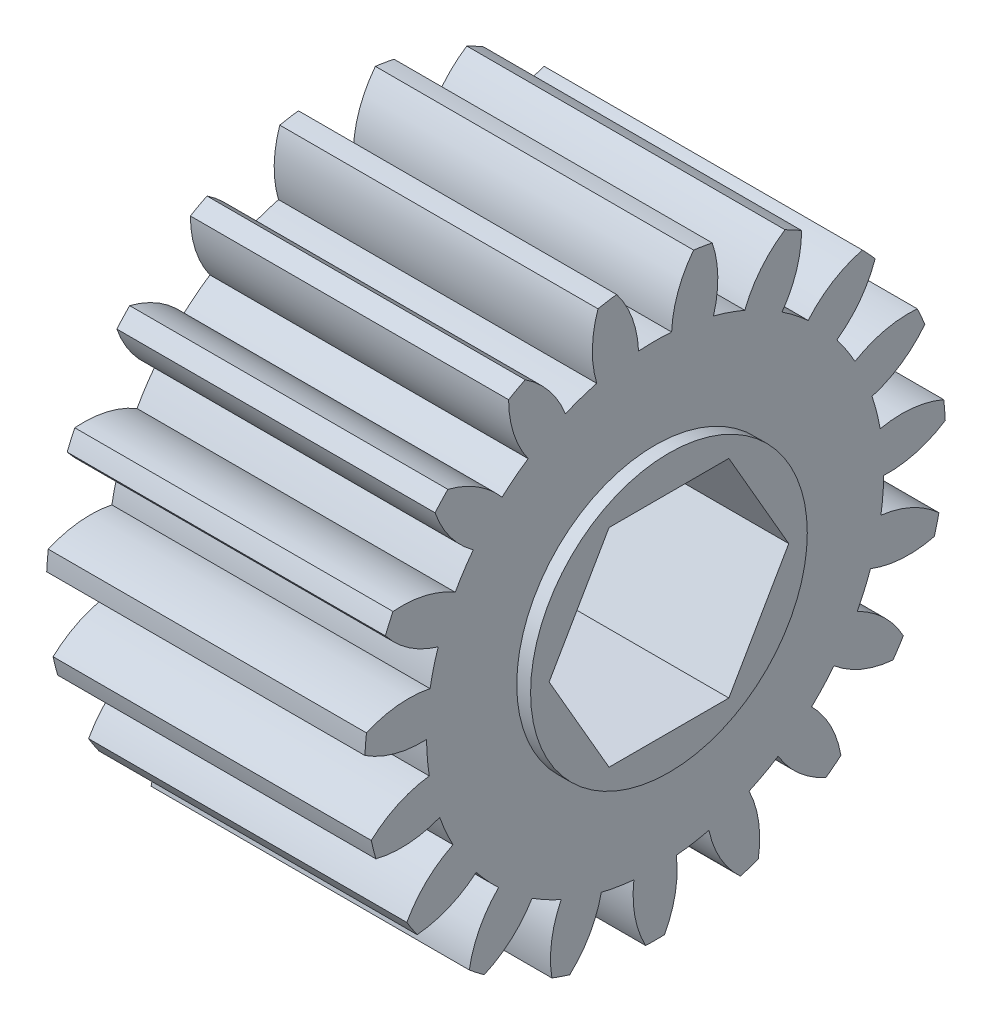
from build123d import *

# Parameters (mm, degrees)
SPUR_START             = -35.678146729
SPUR_GEAR_AI_OUTLINE_R = 4.7625
SPUR_GEAR_AI_DEPTH     = 14.605
SKETCH1_R              = 6.35
BOSS_EXTRUDE1_DEPTH    = 0.635
CUT_EXTRUDE1_DEPTH     = 54.813904544


# Read off the part's stored shape, not the designer's step: spur gear_ai
with BuildPart() as part:
    # spur gear_ai outline → spur gear_ai (new body)
    with BuildSketch(Plane.YZ.offset(SPUR_START)):
        with BuildLine():
            ThreePointArc((-4.079820471, 22.697443218), (-3.867365299, 23.075226512), (-3.667299754, 23.459714736))
            ThreePointArc((-3.667299754, 23.459714736), (-4.662813868, 24.560584868), (-5.94579254, 25.306861711))
            ThreePointArc((-5.94579254, 25.306861711), (-5.673335743, 26.015822626), (-5.452889632, 26.742638832))
            ThreePointArc((-5.452889632, 26.742638832), (-3.982066465, 26.54353431), (-2.52029752, 26.800818102))
            ThreePointArc((-2.52029752, 26.800818102), (-2.442019791, 27.227116136), (-2.377637471, 27.655732904))
            ThreePointArc((-2.377637471, 27.655732904), (-3.676663832, 28.373711952), (-5.132442876, 28.662970963))
            ThreePointArc((-5.132442876, 28.662970963), (-5.104947771, 29.421984997), (-5.132442876, 30.180999032))
            ThreePointArc((-5.132442876, 30.180999032), (-3.676663832, 30.470258044), (-2.377637471, 31.188237091))
            ThreePointArc((-2.377637471, 31.188237091), (-2.442019791, 31.616853859), (-2.52029752, 32.043151894))
            ThreePointArc((-2.52029752, 32.043151894), (-3.982066465, 32.300435686), (-5.452889632, 32.101331163))
            ThreePointArc((-5.452889632, 32.101331163), (-5.673335743, 32.82814737), (-5.94579254, 33.537108285))
            ThreePointArc((-5.94579254, 33.537108285), (-4.662813868, 34.283385128), (-3.667299754, 35.38425526))
            ThreePointArc((-3.667299754, 35.38425526), (-3.867365299, 35.768743484), (-4.079820471, 36.146526778))
            ThreePointArc((-4.079820471, 36.146526778), (-5.545926653, 35.915234624), (-6.872407431, 35.249342632))
            ThreePointArc((-6.872407431, 35.249342632), (-7.316906, 35.865199196), (-7.80479957, 36.447280076))
            ThreePointArc((-7.80479957, 36.447280076), (-6.833651916, 37.569704075), (-6.24952945, 38.934168931))
            ThreePointArc((-6.24952945, 38.934168931), (-6.563598014, 39.232863347), (-6.887207813, 39.521193218))
            ThreePointArc((-6.887207813, 39.521193218), (-8.198775879, 38.826389212), (-9.237169493, 37.76586948))
            ThreePointArc((-9.237169493, 37.76586948), (-9.857552203, 38.204028788), (-10.508011706, 38.596152137))
            ThreePointArc((-10.508011706, 38.596152137), (-9.953933988, 39.973091236), (-9.844501902, 41.453289877))
            ThreePointArc((-9.844501902, 41.453289877), (-10.238539284, 41.633822309), (-10.638235568, 41.801453743))
            ThreePointArc((-10.638235568, 41.801453743), (-11.653136766, 40.718430679), (-12.290917156, 39.378206976))
            ThreePointArc((-12.290917156, 39.378206976), (-13.019955914, 39.591187668), (-13.76249397, 39.750860836))
            ThreePointArc((-13.76249397, 39.750860836), (-13.685529105, 41.233102318), (-14.062646066, 42.668632254))
            ThreePointArc((-14.062646066, 42.668632254), (-14.4939522, 42.711439212), (-14.926421674, 42.740206741))
            ThreePointArc((-14.926421674, 42.740206741), (-15.534675712, 41.386326974), (-15.702729477, 39.911633334))
            ThreePointArc((-15.702729477, 39.911633334), (-16.461421622, 39.876355646), (-17.215572711, 39.78627557))
            ThreePointArc((-17.215572711, 39.78627557), (-17.624061036, 41.21319557), (-18.446860568, 42.448494858))
            ThreePointArc((-18.446860568, 42.448494858), (-18.868696742, 42.348937544), (-19.287074629, 42.23572376))
            ThreePointArc((-19.287074629, 42.23572376), (-19.422767744, 40.75770117), (-19.10288365, 39.308343531))
            ThreePointArc((-19.10288365, 39.308343531), (-19.809013115, 39.028630349), (-20.493053265, 38.698558601))
            ThreePointArc((-20.493053265, 38.698558601), (-21.342728733, 39.915528197), (-22.52204774, 40.816732991))
            ThreePointArc((-22.52204774, 40.816732991), (-22.88870146, 40.585599985), (-23.247650023, 40.342673359))
            ThreePointArc((-23.247650023, 40.342673359), (-22.89607776, 38.900674627), (-22.122920213, 37.633713378))
            ThreePointArc((-22.122920213, 37.633713378), (-22.699966914, 37.139875965), (-23.239769761, 36.605580942))
            ThreePointArc((-23.239769761, 36.605580942), (-24.43855685, 37.480722595), (-25.846597818, 37.950173372))
            ThreePointArc((-25.846597818, 37.950173372), (-26.118336464, 37.612511521), (-26.378958058, 37.266196922))
            ThreePointArc((-26.378958058, 37.266196922), (-25.578218727, 36.016484986), (-24.435571343, 35.069215037))
            ThreePointArc((-24.435571343, 35.069215037), (-24.821003316, 34.41476834), (-25.158072845, 33.734149197))
            ThreePointArc((-25.158072845, 33.734149197), (-26.576064374, 34.172627729), (-28.060244216, 34.159452214))
            ThreePointArc((-28.060244216, 34.159452214), (-28.20762069, 33.75185242), (-28.34167292, 33.339678407))
            ThreePointArc((-28.34167292, 33.339678407), (-27.178539052, 32.417678947), (-25.790225405, 31.892751696))
            ThreePointArc((-25.790225405, 31.892751696), (-25.942275116, 31.148615169), (-26.040084614, 30.395427551))
            ThreePointArc((-26.040084614, 30.395427551), (-27.523619197, 30.34972701), (-28.923103999, 29.855352973))
            ThreePointArc((-28.923103999, 29.855352973), (-28.930147771, 29.421984997), (-28.923103999, 28.988617022))
            ThreePointArc((-28.923103999, 28.988617022), (-27.523619197, 28.494242985), (-26.040084614, 28.448542445))
            ThreePointArc((-26.040084614, 28.448542445), (-25.942275116, 27.695354827), (-25.790225405, 26.9512183))
            ThreePointArc((-25.790225405, 26.9512183), (-27.178539052, 26.426291049), (-28.34167292, 25.504291588))
            ThreePointArc((-28.34167292, 25.504291588), (-28.20762069, 25.092117576), (-28.060244216, 24.684517782))
            ThreePointArc((-28.060244216, 24.684517782), (-26.576064374, 24.671342266), (-25.158072845, 25.109820799))
            ThreePointArc((-25.158072845, 25.109820799), (-24.821003316, 24.429201655), (-24.435571343, 23.774754958))
            ThreePointArc((-24.435571343, 23.774754958), (-25.578218727, 22.82748501), (-26.378958058, 21.577773074))
            ThreePointArc((-26.378958058, 21.577773074), (-26.118336464, 21.231458474), (-25.846597818, 20.893796624))
            ThreePointArc((-25.846597818, 20.893796624), (-24.43855685, 21.363247401), (-23.239769761, 22.238389054))
            ThreePointArc((-23.239769761, 22.238389054), (-22.699966914, 21.70409403), (-22.122920213, 21.210256617))
            ThreePointArc((-22.122920213, 21.210256617), (-22.89607776, 19.943295369), (-23.247650023, 18.501296637))
            ThreePointArc((-23.247650023, 18.501296637), (-22.88870146, 18.25837001), (-22.52204774, 18.027237004))
            ThreePointArc((-22.52204774, 18.027237004), (-21.342728733, 18.928441798), (-20.493053265, 20.145411395))
            ThreePointArc((-20.493053265, 20.145411395), (-19.809013115, 19.815339646), (-19.10288365, 19.535626465))
            ThreePointArc((-19.10288365, 19.535626465), (-19.422767744, 18.086268826), (-19.287074629, 16.608246235))
            ThreePointArc((-19.287074629, 16.608246235), (-18.868696743, 16.495032451), (-18.446860568, 16.395475138))
            ThreePointArc((-18.446860568, 16.395475138), (-17.624061036, 17.630774426), (-17.215572711, 19.057694426))
            ThreePointArc((-17.215572711, 19.057694426), (-16.461421622, 18.967614349), (-15.702729477, 18.932336662))
            ThreePointArc((-15.702729477, 18.932336662), (-15.534675712, 17.457643022), (-14.926421674, 16.103763254))
            ThreePointArc((-14.926421674, 16.103763254), (-14.4939522, 16.132530784), (-14.062646066, 16.175337742))
            ThreePointArc((-14.062646066, 16.175337742), (-13.685529105, 17.610867678), (-13.76249397, 19.093109159))
            ThreePointArc((-13.76249397, 19.093109159), (-13.019955914, 19.252782328), (-12.290917156, 19.465763019))
            ThreePointArc((-12.290917156, 19.465763019), (-11.653136766, 18.125539317), (-10.638235568, 17.042516253))
            ThreePointArc((-10.638235568, 17.042516253), (-10.238539284, 17.210147687), (-9.844501902, 17.390680119))
            ThreePointArc((-9.844501902, 17.390680119), (-9.953933988, 18.87087876), (-10.508011706, 20.247817859))
            ThreePointArc((-10.508011706, 20.247817859), (-9.857552203, 20.639941207), (-9.237169493, 21.078100515))
            ThreePointArc((-9.237169493, 21.078100515), (-8.198775879, 20.017580784), (-6.887207813, 19.322776777))
            ThreePointArc((-6.887207813, 19.322776777), (-6.563598014, 19.611106649), (-6.24952945, 19.909801064))
            ThreePointArc((-6.24952945, 19.909801064), (-6.833651916, 21.274265921), (-7.80479957, 22.39668992))
            ThreePointArc((-7.80479957, 22.39668992), (-7.316906, 22.978770799), (-6.872407431, 23.594627364))
            ThreePointArc((-6.872407431, 23.594627364), (-5.545926653, 22.928735372), (-4.079820471, 22.697443218))
        make_face()
        with Locations((-15.595147771, 29.421984998)):
            Circle(SPUR_GEAR_AI_OUTLINE_R, mode=Mode.SUBTRACT)
    extrude(amount=SPUR_GEAR_AI_DEPTH)

    # Sketch1 → Boss-Extrude1 (add)
    with BuildSketch(Plane(origin=(-21.073146729, 0, 0), x_dir=(0, 0, -1), z_dir=(1, 0, 0))):
        with Locations(Location((-29.421984998, -15.595147771, 0), (0, 0, 180))):
            Circle(SKETCH1_R)
    extrude(amount=BOSS_EXTRUDE1_DEPTH)

    # Sketch2 → Cut-Extrude1 (cut, through all)
    with BuildSketch(Plane(origin=(-20.438146729, 0, 0), x_dir=(0, 0, -1), z_dir=(1, 0, 0))):
        Polygon((-26.672354341, -10.832647771), (-32.171615655, -10.832647771), (-34.921246312, -15.595147771), (-32.171615655, -20.357647771), (-26.672354341, -20.357647771), (-23.922723684, -15.595147771), align=None)
    extrude(amount=-CUT_EXTRUDE1_DEPTH, mode=Mode.SUBTRACT)


solid = part.part
